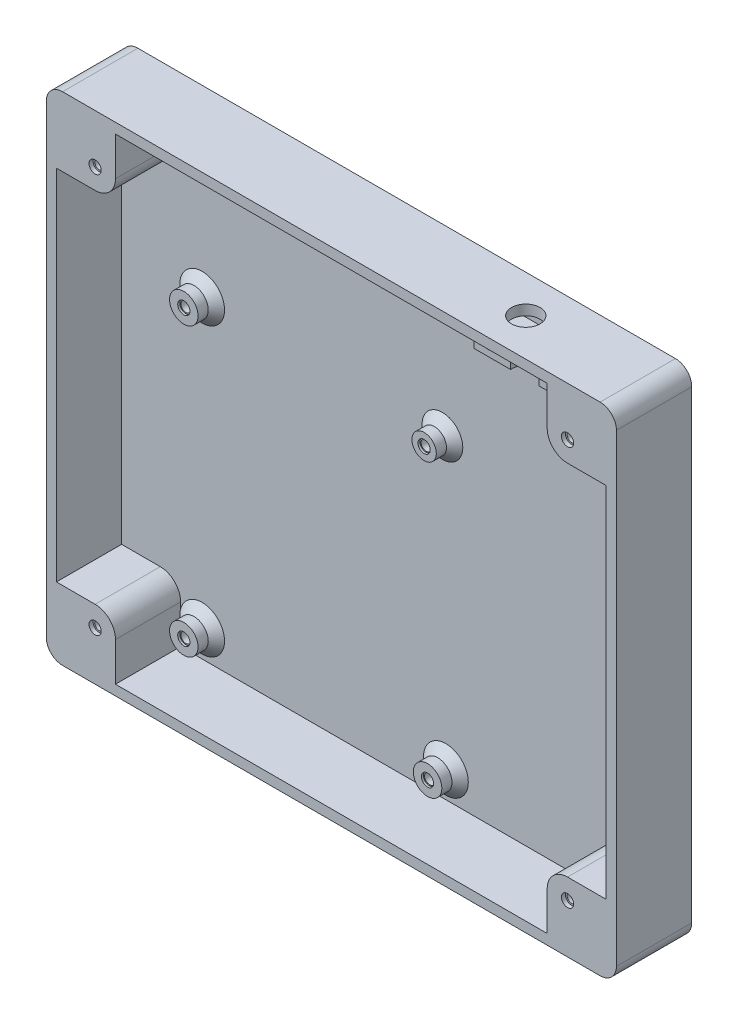
from build123d import *

# Parameters (mm, degrees)
CROQUIS1_W               = 25
CROQUIS1_H               = 6
CROQUIS1_R               = 3.5
CROQUIS1_R_2             = 3
CROQUIS1_R_3             = 1.5
CROQUIS1_R_4             = 1.25
CROQUIS1_R_5             = 1.1
SALIENTE_EXTRUIR5_DEPTH  = 18.5
VACIADO3_T               = -2.5
CROQUIS1_10_R            = 1.5
SALIENTE_EXTRUIR6_DEPTH  = 18.5
SALIENTE_EXTRUIR7_START  = 2.5
CROQUIS1_11_R            = 3.5
CROQUIS1_11_R_2          = 1.5
CROQUIS1_11_R_3          = 3
SALIENTE_EXTRUIR7_DEPTH  = 4.5
CHAFL_N1_SIZE            = 2
SALIENTE_EXTRUIR8_START  = 2.5
CROQUIS1_12_W            = 25
CROQUIS1_12_H            = 6
CROQUIS1_12_R            = 1.5
SALIENTE_EXTRUIR8_DEPTH  = 7
CROQUIS1_13_R            = 1.5
CROQUIS1_13_R_2          = 1.1
SALIENTE_EXTRUIR9_DEPTH  = 17.5
SALIENTE_EXTRUIR10_START = 2.5
CROQUIS1_14_R            = 1.5
CROQUIS1_14_R_2          = 1.25
SALIENTE_EXTRUIR10_DEPTH = 4
CORTAR_EXTRUIR2_START    = 141.704519
CORTAR_EXTRUIR2_DEPTH    = 13.5
CROQUIS1_17_R            = 1.5
CROQUIS1_17_R_2          = 1.25
SALIENTE_EXTRUIR12_DEPTH = 9


with BuildPart() as part:
    # Croquis1 → Saliente-Extruir5 (new body)
    # profile 1 of 32: a face of its own
    with BuildSketch(Plane.XY):
        with BuildLine():
            Line((-41.636272976, 141.704519051), (-41.636272976, 129.704519051))
            ThreePointArc((-41.636272976, 129.704519051), (-43.10073907, 126.168985145), (-46.636272976, 124.704519051))
            Line((-46.636272976, 124.704519051), (-58.636272976, 124.704519051))
            Line((-58.636272976, 124.704519051), (-58.636272976, 36.704519051))
            Line((-58.636272976, 36.704519051), (-46.636272976, 36.704519051))
            ThreePointArc((-46.636272976, 36.704519051), (-43.10073907, 35.240052957), (-41.636272976, 31.704519051))
            Line((-41.636272976, 31.704519051), (-41.636272976, 19.704519051))
            Line((-41.636272976, 19.704519051), (64.363727024, 19.704519051))
            Line((64.363727024, 19.704519051), (64.363727024, 31.704519051))
            ThreePointArc((64.363727024, 31.704519051), (65.828193118, 35.240052957), (69.363727024, 36.704519051))
            Line((69.363727024, 36.704519051), (81.363727024, 36.704519051))
            Line((81.363727024, 36.704519051), (81.363727024, 124.704519051))
            Line((81.363727024, 124.704519051), (69.363727024, 124.704519051))
            ThreePointArc((69.363727024, 124.704519051), (65.828193118, 126.168985145), (64.363727024, 129.704519051))
            Line((64.363727024, 129.704519051), (64.363727024, 141.704519051))
            Line((64.363727024, 141.704519051), (-41.636272976, 141.704519051))
        make_face()
        with BuildLine():
            Line((-40.35710629, 99.239677302), (-40.35710629, 102.746345322))
            Line((-40.35710629, 102.746345322), (-34.597202474, 102.746345322))
            Line((-34.597202474, 102.746345322), (21.034030845, 102.746345322))
            Line((21.034030845, 102.746345322), (26.64289371, 102.746345322))
            Line((26.64289371, 102.746345322), (26.64289371, 99.465838351))
            Line((26.64289371, 99.465838351), (26.64289371, 30.171959952))
            ThreePointArc((26.64289371, 30.171959952), (26.904271731, 29.428969114), (26.99289371, 28.646345322))
            ThreePointArc((26.99289371, 28.646345322), (26.904271731, 27.86372153), (26.64289371, 27.120730691))
            Line((26.64289371, 27.120730691), (26.64289371, 24.746345322))
            Line((26.64289371, 24.746345322), (20.74289371, 24.746345322))
            Line((20.74289371, 24.746345322), (-34.434462508, 24.746345322))
            Line((-34.434462508, 24.746345322), (-40.35710629, 24.746345322))
            Line((-40.35710629, 24.746345322), (-40.35710629, 28.581516019))
            Line((-40.35710629, 28.581516019), (-40.35710629, 99.239677302))
        make_face(mode=Mode.SUBTRACT)
        with Locations((49.86566447, 131.64077129)):
            Rectangle(CROQUIS1_W, CROQUIS1_H, mode=Mode.SUBTRACT)
    # profile 2 of 32: a face of its own
    with BuildSketch(Plane.XY):
        with BuildLine():
            Line((-34.597202474, 102.746345322), (-40.35710629, 102.746345322))
            Line((-40.35710629, 102.746345322), (-40.35710629, 99.239677302))
            Line((-40.35710629, 99.239677302), (-40.35710629, 28.581516019))
            Line((-40.35710629, 28.581516019), (-40.35710629, 24.746345322))
            Line((-40.35710629, 24.746345322), (-34.434462508, 24.746345322))
            Line((-34.434462508, 24.746345322), (20.74289371, 24.746345322))
            Line((20.74289371, 24.746345322), (26.64289371, 24.746345322))
            Line((26.64289371, 24.746345322), (26.64289371, 27.120730691))
            ThreePointArc((26.64289371, 27.120730691), (19.99289371, 28.646345322), (26.64289371, 30.171959952))
            Line((26.64289371, 30.171959952), (26.64289371, 99.465838351))
            Line((26.64289371, 99.465838351), (26.64289371, 102.746345322))
            Line((26.64289371, 102.746345322), (21.034030845, 102.746345322))
            Line((21.034030845, 102.746345322), (-34.597202474, 102.746345322))
        make_face()
        with Locations((-36.35710629, 28.746345322)):
            Circle(CROQUIS1_R, mode=Mode.SUBTRACT)
        with Locations((-36.35710629, 99.146345322)):
            Circle(CROQUIS1_R, mode=Mode.SUBTRACT)
        with Locations((22.64289371, 99.146345322)):
            Circle(CROQUIS1_R_2, mode=Mode.SUBTRACT)
    # profile 3 of 32: a face of its own
    with BuildSketch(Plane.XY):
        with Locations((-36.35710629, 99.146345322)):
            Circle(CROQUIS1_R)
        with Locations((-36.35710629, 99.146345322)):
            Circle(CROQUIS1_R_3, mode=Mode.SUBTRACT)
    # profile 4 of 32: a face of its own
    with BuildSketch(Plane.XY):
        with Locations((-36.35710629, 99.146345322)):
            Circle(CROQUIS1_R_3)
        with Locations((-36.35710629, 99.146345322)):
            Circle(CROQUIS1_R_4, mode=Mode.SUBTRACT)
    # profile 5 of 32: a face of its own
    with BuildSketch(Plane.XY):
        with Locations((-36.35710629, 99.146345322)):
            Circle(CROQUIS1_R_4)
    # profile 6 of 32: a face of its own
    with BuildSketch(Plane.XY):
        with BuildLine():
            ThreePointArc((-46.636272976, 124.704519051), (-43.10073907, 126.168985145), (-41.636272976, 129.704519051))
            Line((-41.636272976, 129.704519051), (-41.636272976, 141.704519051))
            Line((-41.636272976, 141.704519051), (-54.636272976, 141.704519051))
            ThreePointArc((-54.636272976, 141.704519051), (-57.4647001, 140.532946176), (-58.636272976, 137.704519051))
            Line((-58.636272976, 137.704519051), (-58.636272976, 124.704519051))
            Line((-58.636272976, 124.704519051), (-46.636272976, 124.704519051))
        make_face()
        with Locations((-46.636272976, 129.704519051)):
            Circle(CROQUIS1_R_3, mode=Mode.SUBTRACT)
    # profile 7 of 32: a face of its own
    with BuildSketch(Plane.XY):
        with Locations((-46.636272976, 129.704519051)):
            Circle(CROQUIS1_R_3)
        with Locations((-46.636272976, 129.704519051)):
            Circle(CROQUIS1_R_5, mode=Mode.SUBTRACT)
    # profile 8 of 32: a face of its own
    with BuildSketch(Plane.XY):
        with Locations((-46.636272976, 129.704519051)):
            Circle(CROQUIS1_R_5)
    # profile 9 of 32: a face of its own
    with BuildSketch(Plane.XY):
        with BuildLine():
            Line((77.363727024, 141.704519051), (64.363727024, 141.704519051))
            Line((64.363727024, 141.704519051), (64.363727024, 129.704519051))
            ThreePointArc((64.363727024, 129.704519051), (65.828193118, 126.168985145), (69.363727024, 124.704519051))
            Line((69.363727024, 124.704519051), (81.363727024, 124.704519051))
            Line((81.363727024, 124.704519051), (81.363727024, 137.704519051))
            ThreePointArc((81.363727024, 137.704519051), (80.192154149, 140.532946176), (77.363727024, 141.704519051))
        make_face()
        with Locations((69.363727024, 129.704519051)):
            Circle(CROQUIS1_R_3, mode=Mode.SUBTRACT)
    # profile 10 of 32: a face of its own
    with BuildSketch(Plane.XY):
        with Locations((69.363727024, 129.704519051)):
            Circle(CROQUIS1_R_3)
        with Locations((69.363727024, 129.704519051)):
            Circle(CROQUIS1_R_5, mode=Mode.SUBTRACT)
    # profile 11 of 32: a face of its own
    with BuildSketch(Plane.XY):
        with Locations((69.363727024, 129.704519051)):
            Circle(CROQUIS1_R_5)
    # profile 12 of 32: a face of its own
    with BuildSketch(Plane.XY):
        with Locations((49.86566447, 131.64077129)):
            Rectangle(CROQUIS1_W, CROQUIS1_H)
        with Locations((58.86566447, 131.64077129)):
            Circle(CROQUIS1_R_3, mode=Mode.SUBTRACT)
        with Locations((40.86566447, 131.64077129)):
            Circle(CROQUIS1_R_3, mode=Mode.SUBTRACT)
    # profile 13 of 32: a face of its own
    with BuildSketch(Plane.XY):
        with Locations((58.86566447, 131.64077129)):
            Circle(CROQUIS1_R_3)
        with Locations((58.86566447, 131.64077129)):
            Circle(CROQUIS1_R_4, mode=Mode.SUBTRACT)
    # profile 14 of 32: a face of its own
    with BuildSketch(Plane.XY):
        with Locations((58.86566447, 131.64077129)):
            Circle(CROQUIS1_R_4)
    # profile 15 of 32: a face of its own
    with BuildSketch(Plane.XY):
        with Locations((40.86566447, 131.64077129)):
            Circle(CROQUIS1_R_3)
        with Locations((40.86566447, 131.64077129)):
            Circle(CROQUIS1_R_4, mode=Mode.SUBTRACT)
    # profile 16 of 32: a face of its own
    with BuildSketch(Plane.XY):
        with Locations((40.86566447, 131.64077129)):
            Circle(CROQUIS1_R_4)
    # profile 17 of 32: a face of its own
    with BuildSketch(Plane.XY):
        with Locations((22.64289371, 99.146345322)):
            Circle(CROQUIS1_R_2)
        with Locations((22.64289371, 99.146345322)):
            Circle(CROQUIS1_R_3, mode=Mode.SUBTRACT)
    # profile 18 of 32: a face of its own
    with BuildSketch(Plane.XY):
        with Locations((22.64289371, 99.146345322)):
            Circle(CROQUIS1_R_3)
        with Locations((22.64289371, 99.146345322)):
            Circle(CROQUIS1_R_4, mode=Mode.SUBTRACT)
    # profile 19 of 32: a face of its own
    with BuildSketch(Plane.XY):
        with Locations((22.64289371, 99.146345322)):
            Circle(CROQUIS1_R_4)
    # profile 20 of 32: a face of its own
    with BuildSketch(Plane.XY):
        with BuildLine():
            Line((-46.636272976, 36.704519051), (-58.636272976, 36.704519051))
            Line((-58.636272976, 36.704519051), (-58.636272976, 23.704519051))
            ThreePointArc((-58.636272976, 23.704519051), (-57.4647001, 20.876091926), (-54.636272976, 19.704519051))
            Line((-54.636272976, 19.704519051), (-41.636272976, 19.704519051))
            Line((-41.636272976, 19.704519051), (-41.636272976, 31.704519051))
            ThreePointArc((-41.636272976, 31.704519051), (-43.10073907, 35.240052957), (-46.636272976, 36.704519051))
        make_face()
        with Locations((-46.636272976, 31.704519051)):
            Circle(CROQUIS1_R_3, mode=Mode.SUBTRACT)
    # profile 21 of 32: a face of its own
    with BuildSketch(Plane.XY):
        with Locations((-46.636272976, 31.704519051)):
            Circle(CROQUIS1_R_3)
        with Locations((-46.636272976, 31.704519051)):
            Circle(CROQUIS1_R_5, mode=Mode.SUBTRACT)
    # profile 22 of 32: a face of its own
    with BuildSketch(Plane.XY):
        with Locations((-46.636272976, 31.704519051)):
            Circle(CROQUIS1_R_5)
    # profile 23 of 32: a face of its own
    with BuildSketch(Plane.XY):
        with Locations((-36.35710629, 28.746345322)):
            Circle(CROQUIS1_R)
        with Locations((-36.35710629, 28.746345322)):
            Circle(CROQUIS1_R_3, mode=Mode.SUBTRACT)
    # profile 24 of 32: a face of its own
    with BuildSketch(Plane.XY):
        with Locations((-36.35710629, 28.746345322)):
            Circle(CROQUIS1_R_3)
        with Locations((-36.35710629, 28.746345322)):
            Circle(CROQUIS1_R_4, mode=Mode.SUBTRACT)
    # profile 25 of 32: a face of its own
    with BuildSketch(Plane.XY):
        with Locations((-36.35710629, 28.746345322)):
            Circle(CROQUIS1_R_4)
    # profile 26 of 32: a face of its own
    with BuildSketch(Plane.XY):
        with BuildLine():
            Line((26.64289371, 27.946345322), (26.64289371, 30.171959952))
            ThreePointArc((26.64289371, 30.171959952), (19.99289371, 28.646345322), (26.64289371, 27.120730691))
            Line((26.64289371, 27.120730691), (26.64289371, 27.946345322))
        make_face()
        with Locations((23.49289371, 28.646345322)):
            Circle(CROQUIS1_R_3, mode=Mode.SUBTRACT)
    # profile 27 of 32: a face of its own
    with BuildSketch(Plane.XY):
        with BuildLine():
            ThreePointArc((26.99289371, 28.646345322), (26.904271731, 29.428969114), (26.64289371, 30.171959952))
            Line((26.64289371, 30.171959952), (26.64289371, 27.946345322))
            Line((26.64289371, 27.946345322), (26.64289371, 27.120730691))
            ThreePointArc((26.64289371, 27.120730691), (26.904271731, 27.86372153), (26.99289371, 28.646345322))
        make_face()
    # profile 28 of 32: a face of its own
    with BuildSketch(Plane.XY):
        with Locations((23.49289371, 28.646345322)):
            Circle(CROQUIS1_R_3)
        with Locations((23.49289371, 28.646345322)):
            Circle(CROQUIS1_R_4, mode=Mode.SUBTRACT)
    # profile 29 of 32: a face of its own
    with BuildSketch(Plane.XY):
        with Locations((23.49289371, 28.646345322)):
            Circle(CROQUIS1_R_4)
    # profile 30 of 32: a face of its own
    with BuildSketch(Plane.XY):
        with BuildLine():
            Line((81.363727024, 23.704519051), (81.363727024, 36.704519051))
            Line((81.363727024, 36.704519051), (69.363727024, 36.704519051))
            ThreePointArc((69.363727024, 36.704519051), (65.828193118, 35.240052957), (64.363727024, 31.704519051))
            Line((64.363727024, 31.704519051), (64.363727024, 19.704519051))
            Line((64.363727024, 19.704519051), (77.363727024, 19.704519051))
            ThreePointArc((77.363727024, 19.704519051), (80.192154149, 20.876091926), (81.363727024, 23.704519051))
        make_face()
        with Locations((69.363727024, 31.704519051)):
            Circle(CROQUIS1_R_3, mode=Mode.SUBTRACT)
    # profile 31 of 32: a face of its own
    with BuildSketch(Plane.XY):
        with Locations((69.363727024, 31.704519051)):
            Circle(CROQUIS1_R_3)
        with Locations((69.363727024, 31.704519051)):
            Circle(CROQUIS1_R_5, mode=Mode.SUBTRACT)
    # profile 32 of 32: a face of its own
    with BuildSketch(Plane.XY):
        with Locations((69.363727024, 31.704519051)):
            Circle(CROQUIS1_R_5)
    extrude(amount=SALIENTE_EXTRUIR5_DEPTH)

    # Vaciado3
    vaciado3_openings = [part.faces().sort_by_distance(p)[0] for p in [
        (11.363727024, 80.704519051, 18.5),
    ]]
    offset(amount=VACIADO3_T, openings=vaciado3_openings, kind=Kind.INTERSECTION)

    # Croquis1<10> → Saliente-Extruir6 (add)
    # profile 1 of 4: a face of its own
    with BuildSketch(Plane.XY):
        with BuildLine():
            ThreePointArc((-46.636272976, 124.704519051), (-43.10073907, 126.168985145), (-41.636272976, 129.704519051))
            Line((-41.636272976, 129.704519051), (-41.636272976, 141.704519051))
            Line((-41.636272976, 141.704519051), (-54.636272976, 141.704519051))
            ThreePointArc((-54.636272976, 141.704519051), (-57.4647001, 140.532946176), (-58.636272976, 137.704519051))
            Line((-58.636272976, 137.704519051), (-58.636272976, 124.704519051))
            Line((-58.636272976, 124.704519051), (-46.636272976, 124.704519051))
        make_face()
        with Locations((-46.636272976, 129.704519051)):
            Circle(CROQUIS1_10_R, mode=Mode.SUBTRACT)
    # profile 2 of 4: a face of its own
    with BuildSketch(Plane.XY):
        with BuildLine():
            Line((77.363727024, 141.704519051), (64.363727024, 141.704519051))
            Line((64.363727024, 141.704519051), (64.363727024, 129.704519051))
            ThreePointArc((64.363727024, 129.704519051), (65.828193118, 126.168985145), (69.363727024, 124.704519051))
            Line((69.363727024, 124.704519051), (81.363727024, 124.704519051))
            Line((81.363727024, 124.704519051), (81.363727024, 137.704519051))
            ThreePointArc((81.363727024, 137.704519051), (80.192154149, 140.532946176), (77.363727024, 141.704519051))
        make_face()
        with Locations((69.363727024, 129.704519051)):
            Circle(CROQUIS1_10_R, mode=Mode.SUBTRACT)
    # profile 3 of 4: a face of its own
    with BuildSketch(Plane.XY):
        with BuildLine():
            Line((81.363727024, 23.704519051), (81.363727024, 36.704519051))
            Line((81.363727024, 36.704519051), (69.363727024, 36.704519051))
            ThreePointArc((69.363727024, 36.704519051), (65.828193118, 35.240052957), (64.363727024, 31.704519051))
            Line((64.363727024, 31.704519051), (64.363727024, 19.704519051))
            Line((64.363727024, 19.704519051), (77.363727024, 19.704519051))
            ThreePointArc((77.363727024, 19.704519051), (80.192154149, 20.876091926), (81.363727024, 23.704519051))
        make_face()
        with Locations((69.363727024, 31.704519051)):
            Circle(CROQUIS1_10_R, mode=Mode.SUBTRACT)
    # profile 4 of 4: a face of its own
    with BuildSketch(Plane.XY):
        with BuildLine():
            Line((-46.636272976, 36.704519051), (-58.636272976, 36.704519051))
            Line((-58.636272976, 36.704519051), (-58.636272976, 23.704519051))
            ThreePointArc((-58.636272976, 23.704519051), (-57.4647001, 20.876091926), (-54.636272976, 19.704519051))
            Line((-54.636272976, 19.704519051), (-41.636272976, 19.704519051))
            Line((-41.636272976, 19.704519051), (-41.636272976, 31.704519051))
            ThreePointArc((-41.636272976, 31.704519051), (-43.10073907, 35.240052957), (-46.636272976, 36.704519051))
        make_face()
        with Locations((-46.636272976, 31.704519051)):
            Circle(CROQUIS1_10_R, mode=Mode.SUBTRACT)
    extrude(amount=SALIENTE_EXTRUIR6_DEPTH)

    # Croquis1<11> → Saliente-Extruir7 (add)
    # profile 1 of 5: a face of its own
    with BuildSketch(Plane.XY.offset(SALIENTE_EXTRUIR7_START)):
        with Locations((-36.35710629, 28.746345322)):
            Circle(CROQUIS1_11_R)
        with Locations((-36.35710629, 28.746345322)):
            Circle(CROQUIS1_11_R_2, mode=Mode.SUBTRACT)
    # profile 2 of 5: a face of its own
    with BuildSketch(Plane.XY.offset(SALIENTE_EXTRUIR7_START)):
        with BuildLine():
            Line((26.64289371, 27.946345322), (26.64289371, 30.171959952))
            ThreePointArc((26.64289371, 30.171959952), (19.99289371, 28.646345322), (26.64289371, 27.120730691))
            Line((26.64289371, 27.120730691), (26.64289371, 27.946345322))
        make_face()
        with Locations((23.49289371, 28.646345322)):
            Circle(CROQUIS1_11_R_2, mode=Mode.SUBTRACT)
    # profile 3 of 5: a face of its own
    with BuildSketch(Plane.XY.offset(SALIENTE_EXTRUIR7_START)):
        with Locations((22.64289371, 99.146345322)):
            Circle(CROQUIS1_11_R_3)
        with Locations((22.64289371, 99.146345322)):
            Circle(CROQUIS1_11_R_2, mode=Mode.SUBTRACT)
    # profile 4 of 5: a face of its own
    with BuildSketch(Plane.XY.offset(SALIENTE_EXTRUIR7_START)):
        with Locations((-36.35710629, 99.146345322)):
            Circle(CROQUIS1_11_R)
        with Locations((-36.35710629, 99.146345322)):
            Circle(CROQUIS1_11_R_2, mode=Mode.SUBTRACT)
    # profile 5 of 5: a face of its own
    with BuildSketch(Plane.XY.offset(SALIENTE_EXTRUIR7_START)):
        with BuildLine():
            ThreePointArc((26.99289371, 28.646345322), (26.904271731, 29.428969114), (26.64289371, 30.171959952))
            Line((26.64289371, 30.171959952), (26.64289371, 27.946345322))
            Line((26.64289371, 27.946345322), (26.64289371, 27.120730691))
            ThreePointArc((26.64289371, 27.120730691), (26.904271731, 27.86372153), (26.99289371, 28.646345322))
        make_face()
    extrude(amount=SALIENTE_EXTRUIR7_DEPTH)

    # Chaflán1
    # the kernel refuses this chamfer: 2 mm, written as the material it adds along each edge
    with BuildSketch(Plane(origin=(-36.35710629, 28.746345322, 2.5), x_dir=(1, 0, 0), z_dir=(0, -1, 0))) as chafl_n1_piece_1:
        Polygon((3.5 + CHAFL_N1_SIZE, 0), (3.5, CHAFL_N1_SIZE), (3.5, 0), align=None)
    revolve(axis=Axis((-36.35710629, 28.746345322, 2.5), (0, 0, 1)))
    with BuildSketch(Plane(origin=(22.64289371, 99.146345322, 2.5), x_dir=(1, 0, 0), z_dir=(0, -1, 0))) as chafl_n1_piece_2:
        Polygon((3 + CHAFL_N1_SIZE, 0), (3, CHAFL_N1_SIZE), (3, 0), align=None)
    revolve(axis=Axis((22.64289371, 99.146345322, 2.5), (0, 0, 1)))
    with BuildSketch(Plane(origin=(-36.35710629, 99.146345322, 2.5), x_dir=(1, 0, 0), z_dir=(0, -1, 0))) as chafl_n1_piece_3:
        Polygon((3.5 + CHAFL_N1_SIZE, 0), (3.5, CHAFL_N1_SIZE), (3.5, 0), align=None)
    revolve(axis=Axis((-36.35710629, 99.146345322, 2.5), (0, 0, 1)))
    with BuildSketch(Plane(origin=(23.49289371, 28.646345322, 2.5), x_dir=(0.8999999999999787, -0.43588989435411135, 0), z_dir=(0.43588989435411135, 0.8999999999999787, 0))) as chafl_n1_piece_4:
        Polygon((3.5 + CHAFL_N1_SIZE, 0), (3.5, -CHAFL_N1_SIZE), (3.5, 0), align=None)
    revolve(axis=Axis((23.49289371, 28.646345322, 2.5), (0, 0, -1)))

    # Croquis1<12> → Saliente-Extruir8 (add)
    with BuildSketch(Plane.XY.offset(SALIENTE_EXTRUIR8_START)):
        with Locations((49.86566447, 131.64077129)):
            Rectangle(CROQUIS1_12_W, CROQUIS1_12_H)
        with Locations((58.86566447, 131.64077129)):
            Circle(CROQUIS1_12_R, mode=Mode.SUBTRACT)
        with Locations((40.86566447, 131.64077129)):
            Circle(CROQUIS1_12_R, mode=Mode.SUBTRACT)
    extrude(amount=SALIENTE_EXTRUIR8_DEPTH)

    # Croquis1<13> → Saliente-Extruir9 (add)
    # profile 1 of 4: a face of its own
    with BuildSketch(Plane.XY):
        with Locations((-46.636272976, 129.704519051)):
            Circle(CROQUIS1_13_R)
        with Locations((-46.636272976, 129.704519051)):
            Circle(CROQUIS1_13_R_2, mode=Mode.SUBTRACT)
    # profile 2 of 4: a face of its own
    with BuildSketch(Plane.XY):
        with Locations((69.363727024, 129.704519051)):
            Circle(CROQUIS1_13_R)
        with Locations((69.363727024, 129.704519051)):
            Circle(CROQUIS1_13_R_2, mode=Mode.SUBTRACT)
    # profile 3 of 4: a face of its own
    with BuildSketch(Plane.XY):
        with Locations((69.363727024, 31.704519051)):
            Circle(CROQUIS1_13_R)
        with Locations((69.363727024, 31.704519051)):
            Circle(CROQUIS1_13_R_2, mode=Mode.SUBTRACT)
    # profile 4 of 4: a face of its own
    with BuildSketch(Plane.XY):
        with Locations(Location((-46.636272976, 31.704519051, 0), (0, 0, 180))):
            Circle(CROQUIS1_13_R)
        with Locations(Location((-46.636272976, 31.704519051, 0), (0, 0, 180))):
            Circle(CROQUIS1_13_R_2, mode=Mode.SUBTRACT)
    extrude(amount=SALIENTE_EXTRUIR9_DEPTH)

    # Croquis1<14> → Saliente-Extruir10 (add)
    # profile 1 of 4: a face of its own
    with BuildSketch(Plane.XY.offset(SALIENTE_EXTRUIR10_START)):
        with Locations((-36.35710629, 28.746345322)):
            Circle(CROQUIS1_14_R)
        with Locations((-36.35710629, 28.746345322)):
            Circle(CROQUIS1_14_R_2, mode=Mode.SUBTRACT)
    # profile 2 of 4: a face of its own
    with BuildSketch(Plane.XY.offset(SALIENTE_EXTRUIR10_START)):
        with Locations((23.49289371, 28.646345322)):
            Circle(CROQUIS1_14_R)
        with Locations((23.49289371, 28.646345322)):
            Circle(CROQUIS1_14_R_2, mode=Mode.SUBTRACT)
    # profile 3 of 4: a face of its own
    with BuildSketch(Plane.XY.offset(SALIENTE_EXTRUIR10_START)):
        with Locations((22.64289371, 99.146345322)):
            Circle(CROQUIS1_14_R)
        with Locations((22.64289371, 99.146345322)):
            Circle(CROQUIS1_14_R_2, mode=Mode.SUBTRACT)
    # profile 4 of 4: a face of its own
    with BuildSketch(Plane.XY.offset(SALIENTE_EXTRUIR10_START)):
        with Locations((-36.35710629, 99.146345322)):
            Circle(CROQUIS1_14_R)
        with Locations((-36.35710629, 99.146345322)):
            Circle(CROQUIS1_14_R_2, mode=Mode.SUBTRACT)
    extrude(amount=SALIENTE_EXTRUIR10_DEPTH)

    # Croquis3 → Cortar-Extruir2 (cut)
    with BuildSketch(Plane(origin=(0, 0, 0), x_dir=(1, 0, 0), z_dir=(0, 1, 0)).offset(CORTAR_EXTRUIR2_START)):
        with BuildLine():
            ThreePointArc((53.363727024, -9.25), (52.338600759, -6.775126266), (49.863727024, -5.75))
            Line((49.863727024, -5.75), (49.863727024, -9.25))
            Line((49.863727024, -9.25), (53.363727024, -9.25))
        make_face()
        with BuildLine():
            Line((49.863727024, -9.25), (49.863727024, -5.75))
            ThreePointArc((49.863727024, -5.75), (47.38885329, -11.724873734), (53.363727024, -9.25))
            Line((53.363727024, -9.25), (49.863727024, -9.25))
        make_face()
    extrude(amount=-CORTAR_EXTRUIR2_DEPTH, mode=Mode.SUBTRACT)

    # Croquis1<17> → Saliente-Extruir12 (add)
    # profile 1 of 2: a face of its own
    with BuildSketch(Plane.XY):
        with Locations((40.86566447, 131.64077129)):
            Circle(CROQUIS1_17_R)
        with Locations((40.86566447, 131.64077129)):
            Circle(CROQUIS1_17_R_2, mode=Mode.SUBTRACT)
    # profile 2 of 2: a face of its own
    with BuildSketch(Plane.XY):
        with Locations((58.86566447, 131.64077129)):
            Circle(CROQUIS1_17_R)
        with Locations((58.86566447, 131.64077129)):
            Circle(CROQUIS1_17_R_2, mode=Mode.SUBTRACT)
    extrude(amount=SALIENTE_EXTRUIR12_DEPTH)


solid = part.part
